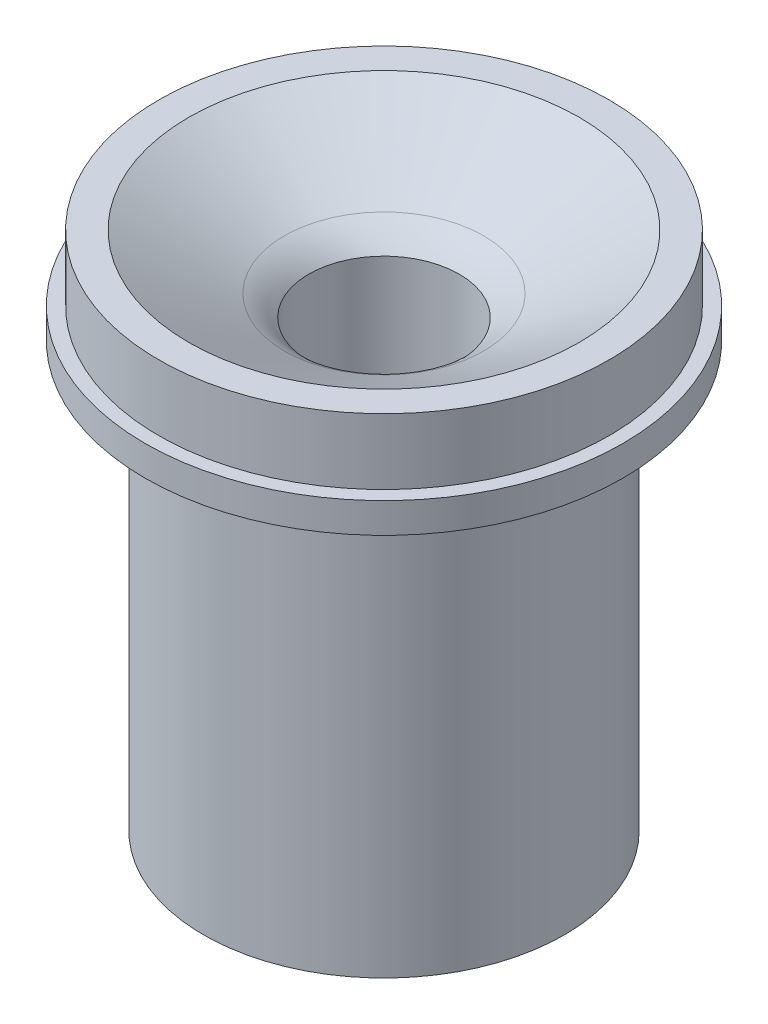
from build123d import *

# Parameters (mm, degrees)
CUT_EXTRUDE1_DEPTH      = 66.493994813
CUT_EXTRUDE1_DEPTH_BACK = 66.493994813
SKETCH2_R               = 7.9375


with BuildPart() as part:
    # Sketch1 → Revolve1 (revolve)
    with BuildSketch(Plane.XY):
        with BuildLine():
            Line((5.771901147, -17.234921768), (15.875, -54.9402))
            Line((15.875, -54.9402), (19.05, -54.9402))
            Line((19.05, -54.9402), (19.05, -13.2842))
            Line((19.05, -13.2842), (20.447, -11.8872))
            Line((20.447, -11.8872), (22.2123, -11.8872))
            Line((22.2123, -11.8872), (22.2123, -10.1092))
            Line((22.2123, -10.1092), (25.2095, -10.1092))
            Line((25.2095, -10.1092), (25.2095, -6.9342))
            Line((25.2095, -6.9342), (23.7744, -6.9342))
            Line((23.7744, -6.9342), (23.7744, 0))
            Line((23.7744, 0), (20.5994, 0))
            Line((20.5994, 0), (10.534401147, -5.811029797))
            ThreePointArc((10.534401147, -5.811029797), (7.048009176, -9.297421768), (5.771901147, -14.059921768))
            Line((5.771901147, -14.059921768), (5.771901147, -17.234921768))
        make_face()
    revolve(axis=Axis((0, 0, 0), (0, 1, 0)))

    # Sketch2 → Cut-Extrude1 (cut, two sides: drawn at the far end of the back side and taken through both)
    with BuildSketch(Plane(origin=(0, 0, 0), x_dir=(1, 0, 0), z_dir=(0, 1, 0)).offset(-CUT_EXTRUDE1_DEPTH_BACK)):
        Circle(SKETCH2_R)
    extrude(amount=CUT_EXTRUDE1_DEPTH + CUT_EXTRUDE1_DEPTH_BACK, mode=Mode.SUBTRACT)


solid = part.part
